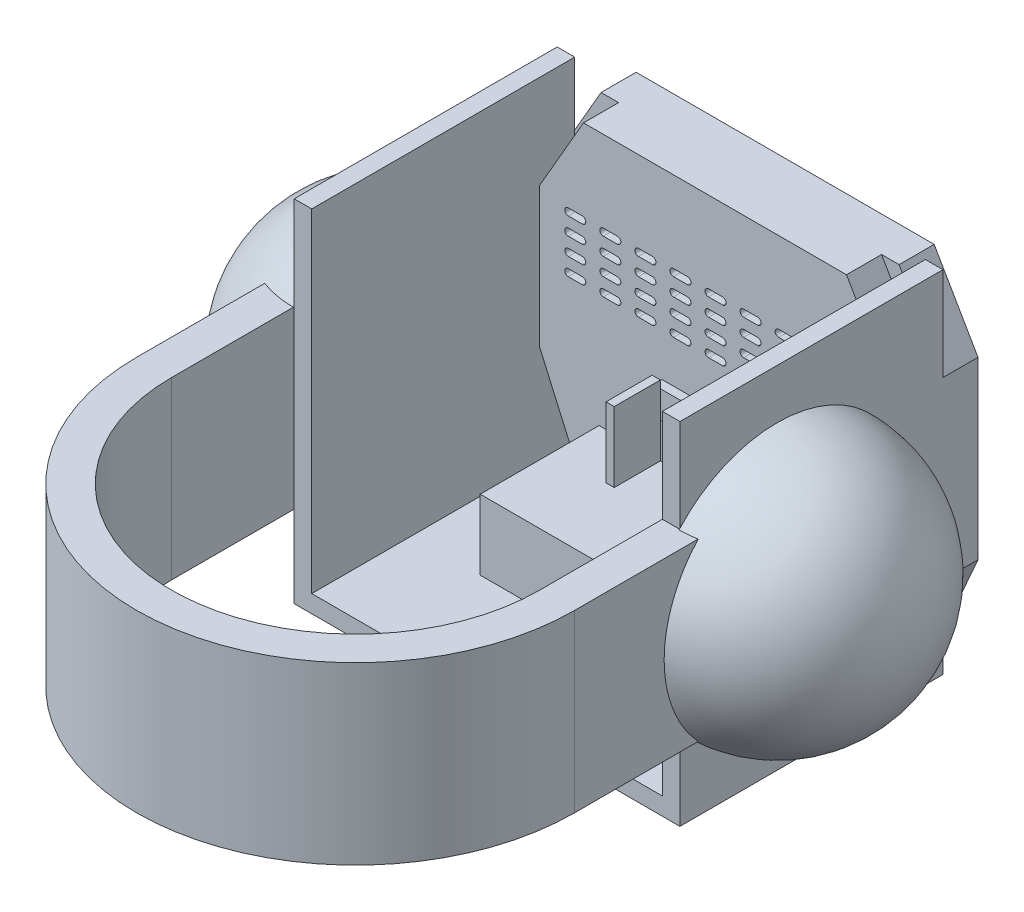
from build123d import *

# Parameters (mm, degrees)
EXTRUDE_1_DEPTH          = 20
CUT_EXTRUDE_1_DEPTH      = 244.077236145
SKETCH_5_W               = 150
SKETCH_5_H               = 190
EXTRUDE_8_DEPTH          = 10
SKETCH_6_W               = 150
SKETCH_6_H               = 190
EXTRUDE_5_DEPTH          = 10
EXTRUDE_6_DEPTH          = 100
SKETCH_8_W               = 220
SKETCH_8_H               = 150
EXTRUDE_7_DEPTH          = 10
EXTRUDE_9_DEPTH          = 20
CUT_EXTRUDE_2_DEPTH      = 20
CUT_EXTRUDE_3_DEPTH      = 20
CUT_EXTRUDE_3_DEPTH_BACK = 419.92754491
SKETCH_12_W              = 124.41031721
SKETCH_12_H              = 67.812466379
EXTRUDE_10_DEPTH         = 40
SKETCH_13_W              = 4.689159909
SKETCH_13_H              = 26.331436413
EXTRUDE_11_DEPTH         = 40
SKETCH_14_W              = 20.537257223
SKETCH_14_H              = 15.492002524
EXTRUDE_12_DEPTH         = 5
SKETCH_16_R              = 2.398187596
EXTRUDE_13_DEPTH         = 1
SKETCH_18_R              = 9.484322411
CUT_EXTRUDE_4_DEPTH      = 10
REVOLVE_1_ANGLE          = 180
REVOLVE_2_ANGLE          = 180


with BuildPart() as part:
    # 草图1 → 凸台-拉伸1 (new body)
    with BuildSketch(Plane.XY):
        Polygon((25, 43.301270189), (175, 43.301270189), (200, 0), (200, -80), (175, -136.698729811), (25, -136.698729811), (0, -80), (0, 0), align=None)
    extrude(amount=EXTRUDE_1_DEPTH)

    # 草图2 → 切除-拉伸1 (cut, through all)
    with BuildSketch(Plane.XY.offset(20)):
        with BuildLine():
            Line((16.307267509, -3), (24.307267509, -3))
            ThreePointArc((24.307267509, -3), (26.307267509, -5), (24.307267509, -7))
            Line((24.307267509, -7), (16.307267509, -7))
            ThreePointArc((16.307267509, -7), (14.307267509, -5), (16.307267509, -3))
        make_face()
        with BuildLine():
            Line((36.307267509, -3), (44.307267509, -3))
            ThreePointArc((44.307267509, -3), (46.307267509, -5), (44.307267509, -7))
            Line((44.307267509, -7), (36.307267509, -7))
            ThreePointArc((36.307267509, -7), (34.307267509, -5), (36.307267509, -3))
        make_face()
        with BuildLine():
            Line((56.307267509, -3), (64.307267509, -3))
            ThreePointArc((64.307267509, -3), (66.307267509, -5), (64.307267509, -7))
            Line((64.307267509, -7), (56.307267509, -7))
            ThreePointArc((56.307267509, -7), (54.307267509, -5), (56.307267509, -3))
        make_face()
        with BuildLine():
            Line((76.307267509, -3), (84.307267509, -3))
            ThreePointArc((84.307267509, -3), (86.307267509, -5), (84.307267509, -7))
            Line((84.307267509, -7), (76.307267509, -7))
            ThreePointArc((76.307267509, -7), (74.307267509, -5), (76.307267509, -3))
        make_face()
        with BuildLine():
            Line((96.307267509, -3), (104.307267509, -3))
            ThreePointArc((104.307267509, -3), (106.307267509, -5), (104.307267509, -7))
            Line((104.307267509, -7), (96.307267509, -7))
            ThreePointArc((96.307267509, -7), (94.307267509, -5), (96.307267509, -3))
        make_face()
        with BuildLine():
            Line((116.307267509, -3), (124.307267509, -3))
            ThreePointArc((124.307267509, -3), (126.307267509, -5), (124.307267509, -7))
            Line((124.307267509, -7), (116.307267509, -7))
            ThreePointArc((116.307267509, -7), (114.307267509, -5), (116.307267509, -3))
        make_face()
        with BuildLine():
            Line((136.307267509, -3), (144.307267509, -3))
            ThreePointArc((144.307267509, -3), (146.307267509, -5), (144.307267509, -7))
            Line((144.307267509, -7), (136.307267509, -7))
            ThreePointArc((136.307267509, -7), (134.307267509, -5), (136.307267509, -3))
        make_face()
        with BuildLine():
            Line((156.307267509, -3), (164.307267509, -3))
            ThreePointArc((164.307267509, -3), (166.307267509, -5), (164.307267509, -7))
            Line((164.307267509, -7), (156.307267509, -7))
            ThreePointArc((156.307267509, -7), (154.307267509, -5), (156.307267509, -3))
        make_face()
        with BuildLine():
            Line((176.307267509, -3), (184.307267509, -3))
            ThreePointArc((184.307267509, -3), (186.307267509, -5), (184.307267509, -7))
            Line((184.307267509, -7), (176.307267509, -7))
            ThreePointArc((176.307267509, -7), (174.307267509, -5), (176.307267509, -3))
        make_face()
        with BuildLine():
            Line((16.307267509, -13), (24.307267509, -13))
            ThreePointArc((24.307267509, -13), (26.307267509, -15), (24.307267509, -17))
            Line((24.307267509, -17), (16.307267509, -17))
            ThreePointArc((16.307267509, -17), (14.307267509, -15), (16.307267509, -13))
        make_face()
        with BuildLine():
            Line((16.307267509, -23), (24.307267509, -23))
            ThreePointArc((24.307267509, -23), (26.307267509, -25), (24.307267509, -27))
            Line((24.307267509, -27), (16.307267509, -27))
            ThreePointArc((16.307267509, -27), (14.307267509, -25), (16.307267509, -23))
        make_face()
        with BuildLine():
            Line((16.307267509, -33), (24.307267509, -33))
            ThreePointArc((24.307267509, -33), (26.307267509, -35), (24.307267509, -37))
            Line((24.307267509, -37), (16.307267509, -37))
            ThreePointArc((16.307267509, -37), (14.307267509, -35), (16.307267509, -33))
        make_face()
        with BuildLine():
            Line((36.307267509, -13), (44.307267509, -13))
            ThreePointArc((44.307267509, -13), (46.307267509, -15), (44.307267509, -17))
            Line((44.307267509, -17), (36.307267509, -17))
            ThreePointArc((36.307267509, -17), (34.307267509, -15), (36.307267509, -13))
        make_face()
        with BuildLine():
            Line((36.307267509, -23), (44.307267509, -23))
            ThreePointArc((44.307267509, -23), (46.307267509, -25), (44.307267509, -27))
            Line((44.307267509, -27), (36.307267509, -27))
            ThreePointArc((36.307267509, -27), (34.307267509, -25), (36.307267509, -23))
        make_face()
        with BuildLine():
            Line((36.307267509, -33), (44.307267509, -33))
            ThreePointArc((44.307267509, -33), (46.307267509, -35), (44.307267509, -37))
            Line((44.307267509, -37), (36.307267509, -37))
            ThreePointArc((36.307267509, -37), (34.307267509, -35), (36.307267509, -33))
        make_face()
        with BuildLine():
            Line((56.307267509, -13), (64.307267509, -13))
            ThreePointArc((64.307267509, -13), (66.307267509, -15), (64.307267509, -17))
            Line((64.307267509, -17), (56.307267509, -17))
            ThreePointArc((56.307267509, -17), (54.307267509, -15), (56.307267509, -13))
        make_face()
        with BuildLine():
            Line((56.307267509, -23), (64.307267509, -23))
            ThreePointArc((64.307267509, -23), (66.307267509, -25), (64.307267509, -27))
            Line((64.307267509, -27), (56.307267509, -27))
            ThreePointArc((56.307267509, -27), (54.307267509, -25), (56.307267509, -23))
        make_face()
        with BuildLine():
            Line((56.307267509, -33), (64.307267509, -33))
            ThreePointArc((64.307267509, -33), (66.307267509, -35), (64.307267509, -37))
            Line((64.307267509, -37), (56.307267509, -37))
            ThreePointArc((56.307267509, -37), (54.307267509, -35), (56.307267509, -33))
        make_face()
        with BuildLine():
            Line((76.307267509, -13), (84.307267509, -13))
            ThreePointArc((84.307267509, -13), (86.307267509, -15), (84.307267509, -17))
            Line((84.307267509, -17), (76.307267509, -17))
            ThreePointArc((76.307267509, -17), (74.307267509, -15), (76.307267509, -13))
        make_face()
        with BuildLine():
            Line((76.307267509, -23), (84.307267509, -23))
            ThreePointArc((84.307267509, -23), (86.307267509, -25), (84.307267509, -27))
            Line((84.307267509, -27), (76.307267509, -27))
            ThreePointArc((76.307267509, -27), (74.307267509, -25), (76.307267509, -23))
        make_face()
        with BuildLine():
            Line((76.307267509, -33), (84.307267509, -33))
            ThreePointArc((84.307267509, -33), (86.307267509, -35), (84.307267509, -37))
            Line((84.307267509, -37), (76.307267509, -37))
            ThreePointArc((76.307267509, -37), (74.307267509, -35), (76.307267509, -33))
        make_face()
        with BuildLine():
            Line((96.307267509, -13), (104.307267509, -13))
            ThreePointArc((104.307267509, -13), (106.307267509, -15), (104.307267509, -17))
            Line((104.307267509, -17), (96.307267509, -17))
            ThreePointArc((96.307267509, -17), (94.307267509, -15), (96.307267509, -13))
        make_face()
        with BuildLine():
            Line((96.307267509, -23), (104.307267509, -23))
            ThreePointArc((104.307267509, -23), (106.307267509, -25), (104.307267509, -27))
            Line((104.307267509, -27), (96.307267509, -27))
            ThreePointArc((96.307267509, -27), (94.307267509, -25), (96.307267509, -23))
        make_face()
        with BuildLine():
            Line((96.307267509, -33), (104.307267509, -33))
            ThreePointArc((104.307267509, -33), (106.307267509, -35), (104.307267509, -37))
            Line((104.307267509, -37), (96.307267509, -37))
            ThreePointArc((96.307267509, -37), (94.307267509, -35), (96.307267509, -33))
        make_face()
        with BuildLine():
            Line((116.307267509, -13), (124.307267509, -13))
            ThreePointArc((124.307267509, -13), (126.307267509, -15), (124.307267509, -17))
            Line((124.307267509, -17), (116.307267509, -17))
            ThreePointArc((116.307267509, -17), (114.307267509, -15), (116.307267509, -13))
        make_face()
        with BuildLine():
            Line((116.307267509, -23), (124.307267509, -23))
            ThreePointArc((124.307267509, -23), (126.307267509, -25), (124.307267509, -27))
            Line((124.307267509, -27), (116.307267509, -27))
            ThreePointArc((116.307267509, -27), (114.307267509, -25), (116.307267509, -23))
        make_face()
        with BuildLine():
            Line((116.307267509, -33), (124.307267509, -33))
            ThreePointArc((124.307267509, -33), (126.307267509, -35), (124.307267509, -37))
            Line((124.307267509, -37), (116.307267509, -37))
            ThreePointArc((116.307267509, -37), (114.307267509, -35), (116.307267509, -33))
        make_face()
        with BuildLine():
            Line((136.307267509, -13), (144.307267509, -13))
            ThreePointArc((144.307267509, -13), (146.307267509, -15), (144.307267509, -17))
            Line((144.307267509, -17), (136.307267509, -17))
            ThreePointArc((136.307267509, -17), (134.307267509, -15), (136.307267509, -13))
        make_face()
        with BuildLine():
            Line((136.307267509, -23), (144.307267509, -23))
            ThreePointArc((144.307267509, -23), (146.307267509, -25), (144.307267509, -27))
            Line((144.307267509, -27), (136.307267509, -27))
            ThreePointArc((136.307267509, -27), (134.307267509, -25), (136.307267509, -23))
        make_face()
        with BuildLine():
            Line((136.307267509, -33), (144.307267509, -33))
            ThreePointArc((144.307267509, -33), (146.307267509, -35), (144.307267509, -37))
            Line((144.307267509, -37), (136.307267509, -37))
            ThreePointArc((136.307267509, -37), (134.307267509, -35), (136.307267509, -33))
        make_face()
        with BuildLine():
            Line((156.307267509, -13), (164.307267509, -13))
            ThreePointArc((164.307267509, -13), (166.307267509, -15), (164.307267509, -17))
            Line((164.307267509, -17), (156.307267509, -17))
            ThreePointArc((156.307267509, -17), (154.307267509, -15), (156.307267509, -13))
        make_face()
        with BuildLine():
            Line((156.307267509, -23), (164.307267509, -23))
            ThreePointArc((164.307267509, -23), (166.307267509, -25), (164.307267509, -27))
            Line((164.307267509, -27), (156.307267509, -27))
            ThreePointArc((156.307267509, -27), (154.307267509, -25), (156.307267509, -23))
        make_face()
        with BuildLine():
            Line((156.307267509, -33), (164.307267509, -33))
            ThreePointArc((164.307267509, -33), (166.307267509, -35), (164.307267509, -37))
            Line((164.307267509, -37), (156.307267509, -37))
            ThreePointArc((156.307267509, -37), (154.307267509, -35), (156.307267509, -33))
        make_face()
        with BuildLine():
            Line((176.307267509, -13), (184.307267509, -13))
            ThreePointArc((184.307267509, -13), (186.307267509, -15), (184.307267509, -17))
            Line((184.307267509, -17), (176.307267509, -17))
            ThreePointArc((176.307267509, -17), (174.307267509, -15), (176.307267509, -13))
        make_face()
        with BuildLine():
            Line((176.307267509, -23), (184.307267509, -23))
            ThreePointArc((184.307267509, -23), (186.307267509, -25), (184.307267509, -27))
            Line((184.307267509, -27), (176.307267509, -27))
            ThreePointArc((176.307267509, -27), (174.307267509, -25), (176.307267509, -23))
        make_face()
        with BuildLine():
            Line((176.307267509, -33), (184.307267509, -33))
            ThreePointArc((184.307267509, -33), (186.307267509, -35), (184.307267509, -37))
            Line((184.307267509, -37), (176.307267509, -37))
            ThreePointArc((176.307267509, -37), (174.307267509, -35), (176.307267509, -33))
        make_face()
    extrude(amount=-CUT_EXTRUDE_1_DEPTH, mode=Mode.SUBTRACT)

    # 草图5 → 凸台-拉伸8 (add)
    with BuildSketch(Plane.ZY):
        with Locations((75, -41.698729811)):
            Rectangle(SKETCH_5_W, SKETCH_5_H)
    extrude(amount=EXTRUDE_8_DEPTH)

    # 草图6 → 凸台-拉伸5 (add)
    with BuildSketch(Plane(origin=(200, 0, 0), x_dir=(0, 0, -1), z_dir=(1, 0, 0))):
        with Locations((-75, -41.698729811)):
            Rectangle(SKETCH_6_W, SKETCH_6_H)
    extrude(amount=EXTRUDE_5_DEPTH)

    # 草图7 → 凸台-拉伸6 (add)
    with BuildSketch(Plane(origin=(0, 0, 0), x_dir=(1, 0, 0), z_dir=(0, 1, 0))):
        with BuildLine():
            Line((-9.998501937, -114.545761813), (-9.998501937, -94.587259876))
            Line((-9.998501937, -94.587259876), (-29.958501937, -94.587259876))
            Line((-29.958501937, -94.587259876), (-29.958501937, -220))
            ThreePointArc((-29.958501937, -220), (95, -344.958501937), (219.958501937, -220))
            Line((219.958501937, -220), (219.958501937, -94.587259876))
            Line((219.958501937, -94.587259876), (199.998501937, -94.587259876))
            Line((199.998501937, -94.587259876), (200, -114.545761813))
            Line((200, -114.545761813), (200, -220))
            ThreePointArc((200, -220), (95, -325), (-10, -220))
            Line((-10, -220), (-10, -114.545761813))
            Line((-10, -114.545761813), (-9.998501937, -114.545761813))
        make_face()
    extrude(amount=-EXTRUDE_6_DEPTH)

    # 草图8 → 凸台-拉伸7 (add)
    with BuildSketch(Plane.XZ.offset(136.698729811)):
        with Locations((100, 75)):
            Rectangle(SKETCH_8_W, SKETCH_8_H)
    extrude(amount=EXTRUDE_7_DEPTH)

    # 草图9 → 凸台-拉伸9 (add)
    with BuildSketch(Plane(origin=(0, 0, 0), x_dir=(-1, 0, 0), z_dir=(0, 0, -1))):
        Polygon((-210, 0), (-210, -100), (-189.409269852, -146.698729811), (-10.590730148, -146.698729811), (10, -100), (10, 0), (-15, 43.301270189), (-185, 43.301270189), align=None)
    extrude(amount=EXTRUDE_9_DEPTH)

    # 草图11 → 切除-拉伸2 (cut)
    with BuildSketch(Plane(origin=(0, 0, -20), x_dir=(-1, 0, 0), z_dir=(0, 0, -1))):
        with BuildLine():
            ThreePointArc((-130.33522252, -22.707979871), (-155.875565254, -8.866510022), (-183.823049851, -16.793268454))
            ThreePointArc((-183.823049851, -16.793268454), (-184.503387976, -22.318285158), (-178.978371272, -22.998623283))
            ThreePointArc((-178.978371272, -22.998623283), (-156.740843693, -16.691382692), (-136.418654267, -27.704898647))
            ThreePointArc((-136.418654267, -27.704898647), (-130.878479006, -28.248155132), (-130.33522252, -22.707979871))
        make_face()
        with BuildLine():
            ThreePointArc((-75.648719341, -17.4333136), (-45.588607284, -3.007681412), (-15.528495228, -17.4333136))
            ThreePointArc((-15.528495228, -17.4333136), (-16.13665717, -22.966740078), (-21.670083648, -22.358578137))
            ThreePointArc((-21.670083648, -22.358578137), (-45.588607284, -10.880250185), (-69.507130921, -22.358578137))
            ThreePointArc((-69.507130921, -22.358578137), (-75.040557399, -22.966740078), (-75.648719341, -17.4333136))
        make_face()
        with BuildLine():
            ThreePointArc((-156.308204474, -107.644258732), (-99.451181078, -131.195208939), (-42.594157683, -107.644258732))
            ThreePointArc((-42.594157683, -107.644258732), (-42.594157683, -95.258894236), (-54.979522179, -95.258894236))
            ThreePointArc((-54.979522179, -95.258894236), (-99.451181078, -113.679658494), (-143.922839978, -95.258894236))
            ThreePointArc((-143.922839978, -95.258894236), (-156.308204474, -95.258894236), (-156.308204474, -107.644258732))
        make_face()
    extrude(amount=-CUT_EXTRUDE_2_DEPTH, mode=Mode.SUBTRACT)

    # 草图2<3> → 切除-拉伸3 (cut, two sides: drawn at the far end of the back side and taken through both)
    with BuildSketch(Plane.XY.offset(20).offset(-CUT_EXTRUDE_3_DEPTH_BACK)):
        with BuildLine():
            Line((16.307267509, -3), (24.307267509, -3))
            ThreePointArc((24.307267509, -3), (26.307267509, -5), (24.307267509, -7))
            Line((24.307267509, -7), (16.307267509, -7))
            ThreePointArc((16.307267509, -7), (14.307267509, -5), (16.307267509, -3))
        make_face()
        with BuildLine():
            Line((36.307267509, -3), (44.307267509, -3))
            ThreePointArc((44.307267509, -3), (46.307267509, -5), (44.307267509, -7))
            Line((44.307267509, -7), (36.307267509, -7))
            ThreePointArc((36.307267509, -7), (34.307267509, -5), (36.307267509, -3))
        make_face()
        with BuildLine():
            Line((56.307267509, -3), (64.307267509, -3))
            ThreePointArc((64.307267509, -3), (66.307267509, -5), (64.307267509, -7))
            Line((64.307267509, -7), (56.307267509, -7))
            ThreePointArc((56.307267509, -7), (54.307267509, -5), (56.307267509, -3))
        make_face()
        with BuildLine():
            Line((76.307267509, -3), (84.307267509, -3))
            ThreePointArc((84.307267509, -3), (86.307267509, -5), (84.307267509, -7))
            Line((84.307267509, -7), (76.307267509, -7))
            ThreePointArc((76.307267509, -7), (74.307267509, -5), (76.307267509, -3))
        make_face()
        with BuildLine():
            Line((96.307267509, -3), (104.307267509, -3))
            ThreePointArc((104.307267509, -3), (106.307267509, -5), (104.307267509, -7))
            Line((104.307267509, -7), (96.307267509, -7))
            ThreePointArc((96.307267509, -7), (94.307267509, -5), (96.307267509, -3))
        make_face()
        with BuildLine():
            Line((116.307267509, -3), (124.307267509, -3))
            ThreePointArc((124.307267509, -3), (126.307267509, -5), (124.307267509, -7))
            Line((124.307267509, -7), (116.307267509, -7))
            ThreePointArc((116.307267509, -7), (114.307267509, -5), (116.307267509, -3))
        make_face()
        with BuildLine():
            Line((136.307267509, -3), (144.307267509, -3))
            ThreePointArc((144.307267509, -3), (146.307267509, -5), (144.307267509, -7))
            Line((144.307267509, -7), (136.307267509, -7))
            ThreePointArc((136.307267509, -7), (134.307267509, -5), (136.307267509, -3))
        make_face()
        with BuildLine():
            Line((156.307267509, -3), (164.307267509, -3))
            ThreePointArc((164.307267509, -3), (166.307267509, -5), (164.307267509, -7))
            Line((164.307267509, -7), (156.307267509, -7))
            ThreePointArc((156.307267509, -7), (154.307267509, -5), (156.307267509, -3))
        make_face()
        with BuildLine():
            Line((176.307267509, -3), (184.307267509, -3))
            ThreePointArc((184.307267509, -3), (186.307267509, -5), (184.307267509, -7))
            Line((184.307267509, -7), (176.307267509, -7))
            ThreePointArc((176.307267509, -7), (174.307267509, -5), (176.307267509, -3))
        make_face()
        with BuildLine():
            Line((16.307267509, -13), (24.307267509, -13))
            ThreePointArc((24.307267509, -13), (26.307267509, -15), (24.307267509, -17))
            Line((24.307267509, -17), (16.307267509, -17))
            ThreePointArc((16.307267509, -17), (14.307267509, -15), (16.307267509, -13))
        make_face()
        with BuildLine():
            Line((16.307267509, -23), (24.307267509, -23))
            ThreePointArc((24.307267509, -23), (26.307267509, -25), (24.307267509, -27))
            Line((24.307267509, -27), (16.307267509, -27))
            ThreePointArc((16.307267509, -27), (14.307267509, -25), (16.307267509, -23))
        make_face()
        with BuildLine():
            Line((16.307267509, -33), (24.307267509, -33))
            ThreePointArc((24.307267509, -33), (26.307267509, -35), (24.307267509, -37))
            Line((24.307267509, -37), (16.307267509, -37))
            ThreePointArc((16.307267509, -37), (14.307267509, -35), (16.307267509, -33))
        make_face()
        with BuildLine():
            Line((36.307267509, -13), (44.307267509, -13))
            ThreePointArc((44.307267509, -13), (46.307267509, -15), (44.307267509, -17))
            Line((44.307267509, -17), (36.307267509, -17))
            ThreePointArc((36.307267509, -17), (34.307267509, -15), (36.307267509, -13))
        make_face()
        with BuildLine():
            Line((36.307267509, -23), (44.307267509, -23))
            ThreePointArc((44.307267509, -23), (46.307267509, -25), (44.307267509, -27))
            Line((44.307267509, -27), (36.307267509, -27))
            ThreePointArc((36.307267509, -27), (34.307267509, -25), (36.307267509, -23))
        make_face()
        with BuildLine():
            Line((36.307267509, -33), (44.307267509, -33))
            ThreePointArc((44.307267509, -33), (46.307267509, -35), (44.307267509, -37))
            Line((44.307267509, -37), (36.307267509, -37))
            ThreePointArc((36.307267509, -37), (34.307267509, -35), (36.307267509, -33))
        make_face()
        with BuildLine():
            Line((56.307267509, -13), (64.307267509, -13))
            ThreePointArc((64.307267509, -13), (66.307267509, -15), (64.307267509, -17))
            Line((64.307267509, -17), (56.307267509, -17))
            ThreePointArc((56.307267509, -17), (54.307267509, -15), (56.307267509, -13))
        make_face()
        with BuildLine():
            Line((56.307267509, -23), (64.307267509, -23))
            ThreePointArc((64.307267509, -23), (66.307267509, -25), (64.307267509, -27))
            Line((64.307267509, -27), (56.307267509, -27))
            ThreePointArc((56.307267509, -27), (54.307267509, -25), (56.307267509, -23))
        make_face()
        with BuildLine():
            Line((56.307267509, -33), (64.307267509, -33))
            ThreePointArc((64.307267509, -33), (66.307267509, -35), (64.307267509, -37))
            Line((64.307267509, -37), (56.307267509, -37))
            ThreePointArc((56.307267509, -37), (54.307267509, -35), (56.307267509, -33))
        make_face()
        with BuildLine():
            Line((76.307267509, -13), (84.307267509, -13))
            ThreePointArc((84.307267509, -13), (86.307267509, -15), (84.307267509, -17))
            Line((84.307267509, -17), (76.307267509, -17))
            ThreePointArc((76.307267509, -17), (74.307267509, -15), (76.307267509, -13))
        make_face()
        with BuildLine():
            Line((76.307267509, -23), (84.307267509, -23))
            ThreePointArc((84.307267509, -23), (86.307267509, -25), (84.307267509, -27))
            Line((84.307267509, -27), (76.307267509, -27))
            ThreePointArc((76.307267509, -27), (74.307267509, -25), (76.307267509, -23))
        make_face()
        with BuildLine():
            Line((76.307267509, -33), (84.307267509, -33))
            ThreePointArc((84.307267509, -33), (86.307267509, -35), (84.307267509, -37))
            Line((84.307267509, -37), (76.307267509, -37))
            ThreePointArc((76.307267509, -37), (74.307267509, -35), (76.307267509, -33))
        make_face()
        with BuildLine():
            Line((96.307267509, -13), (104.307267509, -13))
            ThreePointArc((104.307267509, -13), (106.307267509, -15), (104.307267509, -17))
            Line((104.307267509, -17), (96.307267509, -17))
            ThreePointArc((96.307267509, -17), (94.307267509, -15), (96.307267509, -13))
        make_face()
        with BuildLine():
            Line((96.307267509, -23), (104.307267509, -23))
            ThreePointArc((104.307267509, -23), (106.307267509, -25), (104.307267509, -27))
            Line((104.307267509, -27), (96.307267509, -27))
            ThreePointArc((96.307267509, -27), (94.307267509, -25), (96.307267509, -23))
        make_face()
        with BuildLine():
            Line((96.307267509, -33), (104.307267509, -33))
            ThreePointArc((104.307267509, -33), (106.307267509, -35), (104.307267509, -37))
            Line((104.307267509, -37), (96.307267509, -37))
            ThreePointArc((96.307267509, -37), (94.307267509, -35), (96.307267509, -33))
        make_face()
        with BuildLine():
            Line((116.307267509, -13), (124.307267509, -13))
            ThreePointArc((124.307267509, -13), (126.307267509, -15), (124.307267509, -17))
            Line((124.307267509, -17), (116.307267509, -17))
            ThreePointArc((116.307267509, -17), (114.307267509, -15), (116.307267509, -13))
        make_face()
        with BuildLine():
            Line((116.307267509, -23), (124.307267509, -23))
            ThreePointArc((124.307267509, -23), (126.307267509, -25), (124.307267509, -27))
            Line((124.307267509, -27), (116.307267509, -27))
            ThreePointArc((116.307267509, -27), (114.307267509, -25), (116.307267509, -23))
        make_face()
        with BuildLine():
            Line((116.307267509, -33), (124.307267509, -33))
            ThreePointArc((124.307267509, -33), (126.307267509, -35), (124.307267509, -37))
            Line((124.307267509, -37), (116.307267509, -37))
            ThreePointArc((116.307267509, -37), (114.307267509, -35), (116.307267509, -33))
        make_face()
        with BuildLine():
            Line((136.307267509, -13), (144.307267509, -13))
            ThreePointArc((144.307267509, -13), (146.307267509, -15), (144.307267509, -17))
            Line((144.307267509, -17), (136.307267509, -17))
            ThreePointArc((136.307267509, -17), (134.307267509, -15), (136.307267509, -13))
        make_face()
        with BuildLine():
            Line((136.307267509, -23), (144.307267509, -23))
            ThreePointArc((144.307267509, -23), (146.307267509, -25), (144.307267509, -27))
            Line((144.307267509, -27), (136.307267509, -27))
            ThreePointArc((136.307267509, -27), (134.307267509, -25), (136.307267509, -23))
        make_face()
        with BuildLine():
            Line((136.307267509, -33), (144.307267509, -33))
            ThreePointArc((144.307267509, -33), (146.307267509, -35), (144.307267509, -37))
            Line((144.307267509, -37), (136.307267509, -37))
            ThreePointArc((136.307267509, -37), (134.307267509, -35), (136.307267509, -33))
        make_face()
        with BuildLine():
            Line((156.307267509, -13), (164.307267509, -13))
            ThreePointArc((164.307267509, -13), (166.307267509, -15), (164.307267509, -17))
            Line((164.307267509, -17), (156.307267509, -17))
            ThreePointArc((156.307267509, -17), (154.307267509, -15), (156.307267509, -13))
        make_face()
        with BuildLine():
            Line((156.307267509, -23), (164.307267509, -23))
            ThreePointArc((164.307267509, -23), (166.307267509, -25), (164.307267509, -27))
            Line((164.307267509, -27), (156.307267509, -27))
            ThreePointArc((156.307267509, -27), (154.307267509, -25), (156.307267509, -23))
        make_face()
        with BuildLine():
            Line((156.307267509, -33), (164.307267509, -33))
            ThreePointArc((164.307267509, -33), (166.307267509, -35), (164.307267509, -37))
            Line((164.307267509, -37), (156.307267509, -37))
            ThreePointArc((156.307267509, -37), (154.307267509, -35), (156.307267509, -33))
        make_face()
        with BuildLine():
            Line((176.307267509, -13), (184.307267509, -13))
            ThreePointArc((184.307267509, -13), (186.307267509, -15), (184.307267509, -17))
            Line((184.307267509, -17), (176.307267509, -17))
            ThreePointArc((176.307267509, -17), (174.307267509, -15), (176.307267509, -13))
        make_face()
        with BuildLine():
            Line((176.307267509, -23), (184.307267509, -23))
            ThreePointArc((184.307267509, -23), (186.307267509, -25), (184.307267509, -27))
            Line((184.307267509, -27), (176.307267509, -27))
            ThreePointArc((176.307267509, -27), (174.307267509, -25), (176.307267509, -23))
        make_face()
        with BuildLine():
            Line((176.307267509, -33), (184.307267509, -33))
            ThreePointArc((184.307267509, -33), (186.307267509, -35), (184.307267509, -37))
            Line((184.307267509, -37), (176.307267509, -37))
            ThreePointArc((176.307267509, -37), (174.307267509, -35), (176.307267509, -33))
        make_face()
    extrude(amount=CUT_EXTRUDE_3_DEPTH + CUT_EXTRUDE_3_DEPTH_BACK, mode=Mode.SUBTRACT)

    # 草图12 → 凸台-拉伸10 (add)
    with BuildSketch(Plane(origin=(0, -136.698729811, 0), x_dir=(1, 0, 0), z_dir=(0, 1, 0))):
        with Locations((101.148364686, -58.95702836)):
            Rectangle(SKETCH_12_W, SKETCH_12_H)
    extrude(amount=EXTRUDE_10_DEPTH)

    # 草图13 → 凸台-拉伸11 (add)
    with BuildSketch(Plane(origin=(0, -96.698729811, 0), x_dir=(1, 0, 0), z_dir=(0, 1, 0))):
        with Locations((71.554200455, -38.216513377)):
            Rectangle(SKETCH_13_W, SKETCH_13_H)
    extrude(amount=EXTRUDE_11_DEPTH)

    # 草图14 → 凸台-拉伸12 (add)
    with BuildSketch(Plane.XY.offset(20)):
        with Locations((79.95542107, -68.828801627)):
            Rectangle(SKETCH_14_W, SKETCH_14_H)
    extrude(amount=EXTRUDE_12_DEPTH)

    # 草图16 → 凸台-拉伸13 (add)
    with BuildSketch(Plane.XY.offset(25)):
        with Locations((81.626812247, -68.397207507)):
            Circle(SKETCH_16_R)
    extrude(amount=EXTRUDE_13_DEPTH)

    # 草图18 → 切除-拉伸4 (cut)
    with BuildSketch(Plane(origin=(210, 0, 0), x_dir=(0, 0, -1), z_dir=(1, 0, 0))):
        with Locations((-25.993159781, -109.666573185)):
            Circle(SKETCH_18_R)
    extrude(amount=-CUT_EXTRUDE_4_DEPTH, mode=Mode.SUBTRACT)

    # 草图19 → 旋转1 (revolve)
    with BuildSketch(Plane(origin=(210, 0, 0), x_dir=(0, 0, -1), z_dir=(1, 0, 0))):
        with BuildLine():
            Line((-169.587259876, -50), (-19.587259876, -50))
            ThreePointArc((-19.587259876, -50), (-94.587259876, 25), (-169.587259876, -50))
        make_face()
    revolve(axis=Axis((210, -50, 169.587259876), (0, 0, -1)), revolution_arc=REVOLVE_1_ANGLE)

    # 草图20 → 旋转2 (revolve)
    with BuildSketch(Plane.ZY.offset(10)):
        with BuildLine():
            Line((169.587259876, -50), (19.587259876, -50))
            ThreePointArc((19.587259876, -50), (94.587259876, 25), (169.587259876, -50))
        make_face()
    revolve(axis=Axis((-10, -50, 169.587259876), (0, 0, 1)), revolution_arc=REVOLVE_2_ANGLE)


solid = part.part
